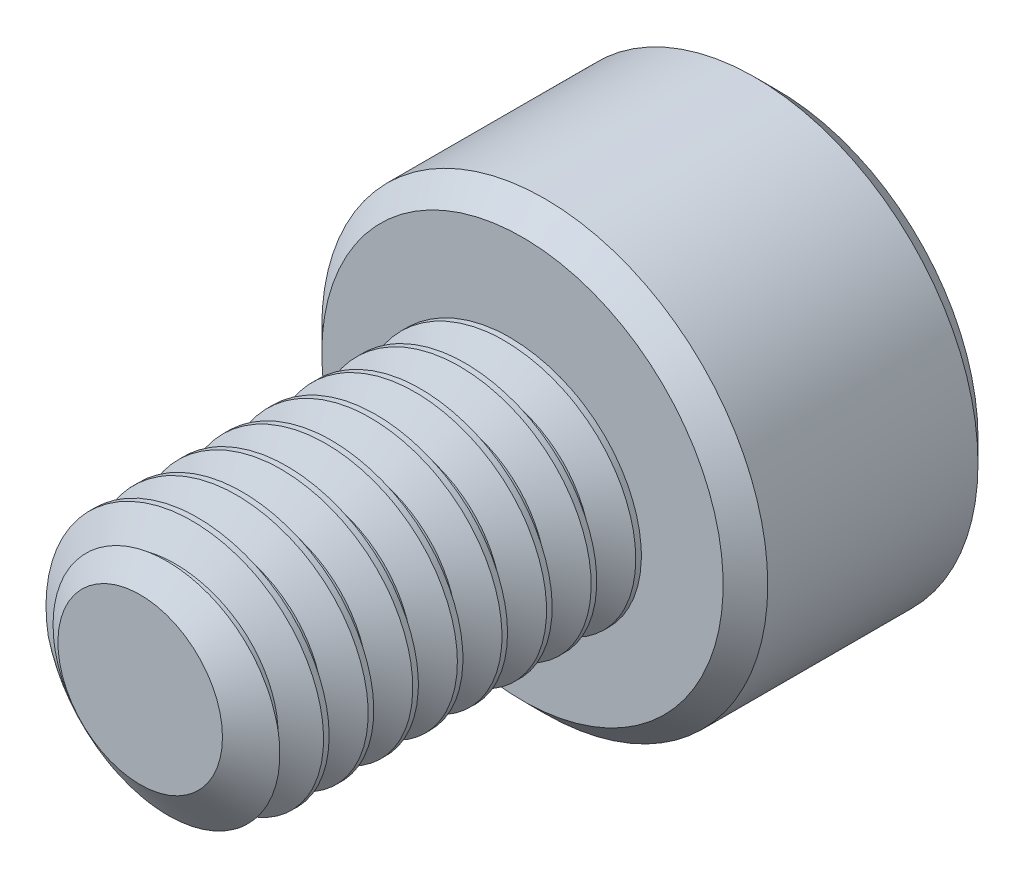
from build123d import *

# Parameters (mm, degrees)
SKETCH1_R          = 2
EXTRUDE1_DEPTH     = 6
CUT_SWEEP1_PITCH   = 0.7
SKETCH6_R          = 3.5
EXTRUDE2_DEPTH     = 4
CUT_EXTRUDE1_DEPTH = 2.25
CHAMFER1_SIZE      = 0.35


with BuildPart() as part:
    # Sketch1 → Extrude1 (new body)
    with BuildSketch(Plane.XY):
        Circle(SKETCH1_R)
    extrude(amount=-EXTRUDE1_DEPTH)

    # Cut-Sweep1: the profile of Sketch3 profile screwed along a right-hand helix of 9.571429 turns, 6 arcs to a turn; built about Z, then put on its axis
    cut_sweep1_z = Axis((0, 0, 0), (0, 0, 1))
    cut_sweep1_corners = [(2.0003, 0, -0.612673205), (1.545336663, 0, -0.35), (1.545336663, 0, -0.2625), (2.0003, 0, 0.000173205)]
    with BuildLine(mode=Mode.PRIVATE) as cut_sweep1_profile:
        Line(cut_sweep1_corners[0], cut_sweep1_corners[1])
        Line(cut_sweep1_corners[1], cut_sweep1_corners[2])
        Line(cut_sweep1_corners[2], cut_sweep1_corners[3])
        Line(cut_sweep1_corners[3], cut_sweep1_corners[0])
    cut_sweep1_cap = Face(cut_sweep1_profile.wire())
    cut_sweep1_turn_angles = [0, 30, 60, 90, 120, 150, 180, 210, 240, 270, 300, 330, 360]
    cut_sweep1_turn_weights = [1, 0.8660254037844387, 1, 0.8660254037844387, 1, 0.8660254037844387, 1, 0.8660254037844387, 1, 0.8660254037844387, 1, 0.8660254037844387, 1]
    cut_sweep1_turn_rails = [Edge.make_bspline([Vector(p[0], p[1], 0).rotate(cut_sweep1_z, cut_sweep1_turn_angles[k]) / cut_sweep1_turn_weights[k] + Vector(0, 0, p[2] + CUT_SWEEP1_PITCH * cut_sweep1_turn_angles[k] / 360) for k in range(13)], [0, 0, 0, 1, 1, 2, 2, 3, 3, 4, 4, 5, 5, 6, 6, 6], 2, cut_sweep1_turn_weights) for p in cut_sweep1_corners]
    cut_sweep1_turn_sides = [Face.make_surface_from_curves(cut_sweep1_turn_rails[p[0]], cut_sweep1_turn_rails[p[1]]) for p in [(0, 1), (1, 2), (2, 3), (3, 0)]]
    cut_sweep1_last_angles = [3240, 3270, 3300, 3330, 3360, 3390, 3420, 3432.857142857, 3445.714285714]
    cut_sweep1_last_weights = [1, 0.8660254037844387, 1, 0.8660254037844387, 1, 0.8660254037844387, 1, 0.9749279121818499, 1]
    cut_sweep1_last_rails = [Edge.make_bspline([Vector(p[0], p[1], 0).rotate(cut_sweep1_z, cut_sweep1_last_angles[k]) / cut_sweep1_last_weights[k] + Vector(0, 0, p[2] + CUT_SWEEP1_PITCH * cut_sweep1_last_angles[k] / 360) for k in range(9)], [0, 0, 0, 1, 1, 2, 2, 3, 3, 4, 4, 4], 2, cut_sweep1_last_weights) for p in cut_sweep1_corners]
    cut_sweep1_last_sides = [Face.make_surface_from_curves(cut_sweep1_last_rails[p[0]], cut_sweep1_last_rails[p[1]]) for p in [(0, 1), (1, 2), (2, 3), (3, 0)]]
    cut_sweep1 = Plane(origin=(0, 0, 0), x_dir=(0, 1, 0), z_dir=(0, 0, -1)) * Solid(Shell([*[p.moved(Location((0, 0, CUT_SWEEP1_PITCH * i))) for i in range(9) for p in cut_sweep1_turn_sides], *cut_sweep1_last_sides, cut_sweep1_cap, cut_sweep1_cap.rotate(cut_sweep1_z, 3445.714285714).moved(Location((0, 0, CUT_SWEEP1_PITCH * 3445.714285714 / 360)))]))
    add(cut_sweep1, mode=Mode.SUBTRACT)

    # Sketch4 → Cut-Revolve1 (revolve, cut)
    with BuildSketch(Plane(origin=(0, 0, 0), x_dir=(0, 0, -1), z_dir=(1, 0, 0)), mode=Mode.PRIVATE) as cut_revolve1_sk:
        Polygon((0.496211411, 2), (0, 1.291336663), (0, 2), align=None)
    revolve(cut_revolve1_sk.sketch.rotate(Axis((0, 0, 0), (0, 0, -1)), 271.401126896), axis=Axis((0, 0, 0), (0, 0, -1)), mode=Mode.SUBTRACT)

    # Sketch6 → Extrude2 (add)
    with BuildSketch(Plane(origin=(0, 0, -6), x_dir=(-1, 0, 0), z_dir=(0, 0, -1))):
        Circle(SKETCH6_R)
    extrude(amount=EXTRUDE2_DEPTH)

    # Sketch7 → Cut-Extrude1 (cut)
    with BuildSketch(Plane(origin=(0, 0, -10), x_dir=(-1, 0, 0), z_dir=(0, 0, -1))):
        Polygon((0, 1.732050808), (-1.5, 0.866025404), (-1.5, -0.866025404), (0, -1.732050808), (1.5, -0.866025404), (1.5, 0.866025404), align=None)
    extrude(amount=-CUT_EXTRUDE1_DEPTH, mode=Mode.SUBTRACT)

    # Cut-Extrude2 cone 1 section (through the dimple's axis) → Cut-Extrude2 (revolve, cut)
    with BuildSketch(Plane(origin=(0, 0, -10), x_dir=(0, 1, 0), z_dir=(1, 0, 0))):
        Polygon((0, 0), (1.732050808, 0), (0, 1.732050808), align=None)
    revolve(axis=Axis((0, 0, -10), (0, 0, 1)), mode=Mode.SUBTRACT)

    # Chamfer1
    chamfer1_edges = [part.edges().sort_by_distance(p)[0] for p in [
        (3.5, 0, -6),
        (3.5, 0, -10),
    ]]
    chamfer(chamfer1_edges, length=CHAMFER1_SIZE)


solid = part.part
